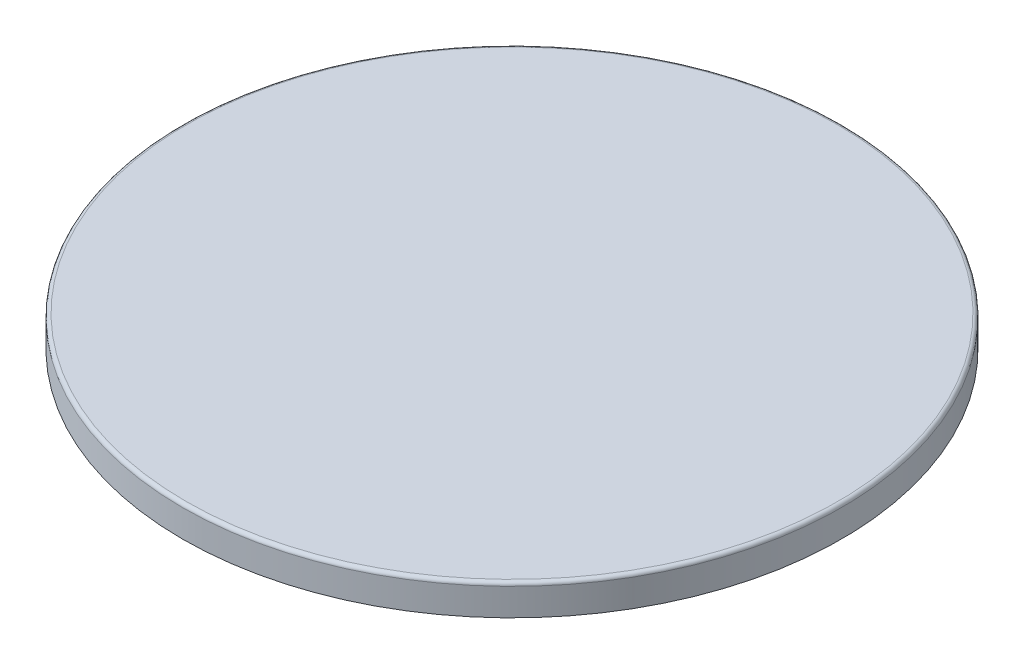
from build123d import *

# Parameters (mm, degrees)
SKETCH1_R          = 158.5
BASE_FLANGE1_DEPTH = 1


# Read off the part's stored shape, not the designer's step: Edge-Flange1
# Sheet-metal steps are written as plain solids
with BuildPart() as part:
    # Sketch1 → Base-Flange1 (new body)
    with BuildSketch(Plane(origin=(0, 0, 0), x_dir=(1, 0, 0), z_dir=(0, 1, 0))):
        with Locations(Location((0, 0, 0), (0, 0, 270))):
            Circle(SKETCH1_R)
    extrude(amount=-BASE_FLANGE1_DEPTH)

    # Edge-Flange1 outline → Edge-Flange1 (revolve)
    with BuildSketch(Plane.XY):
        with BuildLine():
            Line((159.2366, -1.7366), (159.2366, -15))
            Line((159.2366, -15), (160.2366, -15))
            Line((160.2366, -15), (160.2366, -1.7366))
            ThreePointArc((160.2366, -1.7366), (159.727961636, -0.508638364), (158.5, 0))
            Line((158.5, 0), (158.5, -1))
            ThreePointArc((158.5, -1), (159.020854855, -1.215745145), (159.2366, -1.7366))
        make_face()
    revolve(axis=Axis((0, 0, 0), (0, 1, 0)))


solid = part.part
